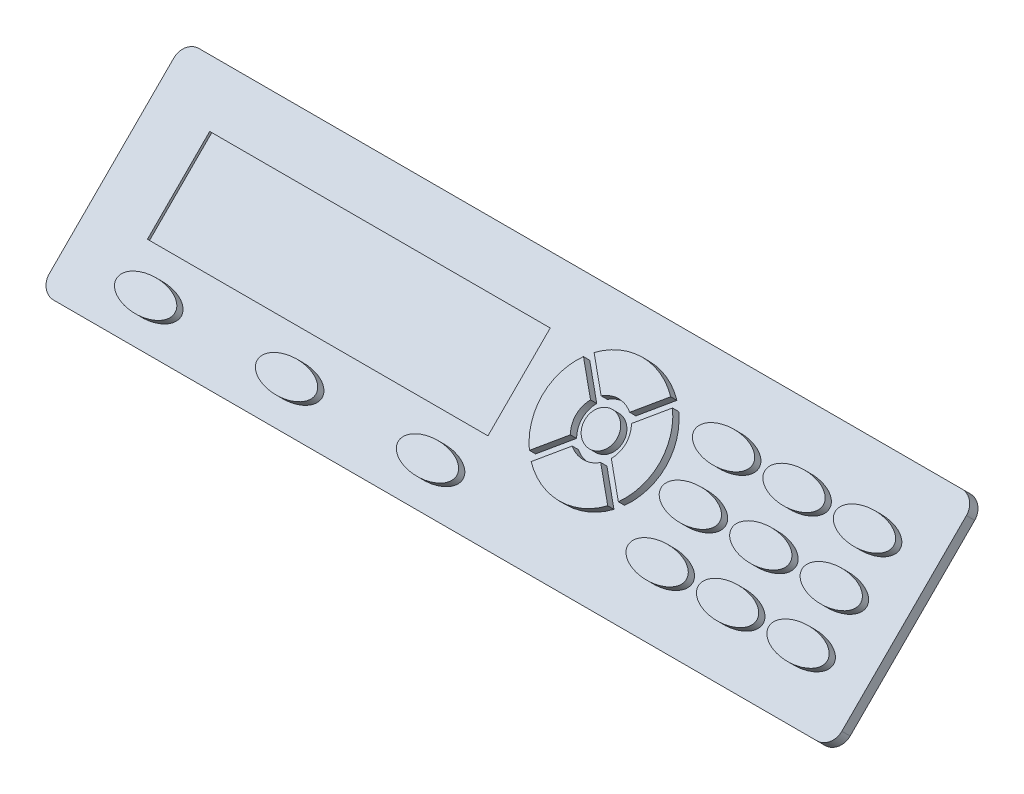
from build123d import *

# Parameters (mm, degrees)
BOSS_EXTRUDE1_DEPTH     = 90
FILLET1_R               = 7.5
FILLET2_R               = 2
SKETCH2_W               = 20
SKETCH2_H               = 80
SKETCH2_W_2             = 32
BOSS_EXTRUDE2_DEPTH     = 20
SKETCH3_R               = 2.5
BOSS_EXTRUDE3_DEPTH     = 111
BOSS_EXTRUDE4_START     = 7.5
SKETCH4_W               = 80
SKETCH4_H               = 20
SKETCH4_R               = 3.25
BOSS_EXTRUDE4_DEPTH     = 20
MOVE_FACE1_BY           = 1.5
MOVE_FACE2_BY           = 1.5
FILLET3_R               = 4
FILLET4_R               = 4
CUT_EXTRUDE1_DEPTH      = 2
BOSS_EXTRUDE5_DEPTH     = 2
SKETCH7_W               = 58
SKETCH7_H               = 15
CUT_EXTRUDE2_DEPTH      = 0.5
SKETCH8_R               = 10
BOSS_EXTRUDE6_DEPTH     = 1.5
SKETCH10_R              = 4.25
SKETCH10_R_2            = 2.75
CUT_EXTRUDE_THIN1_DEPTH = 1.5
SKETCH11_RX             = 5
SKETCH11_RY             = 2.5
BOSS_EXTRUDE7_DEPTH     = 1.5
LPATTERN1_COUNT         = 3
LPATTERN1_PITCH         = 24
SKETCH12_RX             = 5
SKETCH12_RY             = 2.5
BOSS_EXTRUDE8_DEPTH     = 1.5
LPATTERN2_COUNT         = 3
LPATTERN2_PITCH         = 12
LPATTERN2_COUNT_DIR2    = 3
LPATTERN2_PITCH_DIR2    = 8
FILLET7_R               = 7.5
FILLET5_R               = 5
FILLET6_R               = 2
SHELL1_T                = -1
SKETCH14_R              = 14
BOSS_EXTRUDE9_DEPTH     = 1
BOSS_EXTRUDE10_DEPTH    = 1
BOSS_EXTRUDE11_START    = -30
SKETCH16_R              = 13
BOSS_EXTRUDE11_DEPTH    = 10
BOSS_EXTRUDE12_REACH    = 233.484
SKETCH18_R              = 3
SKETCH17_W              = 1.5
SKETCH17_H              = 20
SKETCH17_W_2            = 20
SKETCH17_H_2            = 1.5
EXTRUDE_THIN1_DEPTH     = 63.5
SKETCH20_R              = 12.5
BOSS_EXTRUDE13_DEPTH    = 5
FILLET8_R               = 2


# Read off the part's stored shape, not the designer's step: Body-Move/Copy1
with BuildPart() as part:
    # Sketch1 → Boss-Extrude1 (new, symmetric)
    with BuildSketch(Plane(origin=(0, 0, 0), x_dir=(0, 0, -1), z_dir=(1, 0, 0))):
        Polygon((0, 0), (0, 45), (-115, 45), (-160, 0), align=None)
    extrude(amount=BOSS_EXTRUDE1_DEPTH, both=True)

    # Fillet1
    fillet1_edges = [part.edges().sort_by_distance(p)[0] for p in [
        (0, 0, 160),
        (0, 45, 115),
        (0, 45, 0),
        (0, 0, 0),
    ]]
    fillet(fillet1_edges, radius=FILLET1_R)

    # Fillet2
    fillet2_edges = [part.edges().sort_by_distance(p)[0] for p in [
        (-90, 0, 74.696699141),
        (90, 0, 74.696699141),
        (-90, 27.803300859, 132.196699141),
        (-90, 45, 59.696699141),
        (-90, 22.5, 0),
        (-90, 44.429096494, 114.763524025),
        (-90, 2.196699141, 2.196699141),
        (-90, 42.803300859, 2.196699141),
        (-90, 4.629874257, 148.822494776),
        (90, 27.803300859, 132.196699141),
        (90, 22.5, 0),
        (90, 45, 59.696699141),
        (90, 44.429096494, 114.763524025),
        (90, 2.196699141, 2.196699141),
        (90, 42.803300859, 2.196699141),
        (90, 4.629874257, 148.822494776),
    ]]
    fillet(fillet2_edges, radius=FILLET2_R)

    # Sketch2 → Boss-Extrude2 (add)
    with BuildSketch(Plane(origin=(0, 45, 0), x_dir=(1, 0, 0), z_dir=(0, 1, 0))):
        with Locations((-71.5, -59.696699141)):
            Rectangle(SKETCH2_W, SKETCH2_H)
        with Locations((65.5, -59.696699141)):
            Rectangle(SKETCH2_W_2, SKETCH2_H)
    extrude(amount=BOSS_EXTRUDE2_DEPTH)

    # Sketch3 → Boss-Extrude3 (add)
    with BuildSketch(Plane(origin=(-61.5, 0, 0), x_dir=(0, 0, -1), z_dir=(1, 0, 0))):
        with Locations(Location((-89.696699141, 59.5, 0), (0, 0, 180))):
            Circle(SKETCH3_R)
        with Locations(Location((-89.696699141, 50.5, 0), (0, 0, 180))):
            Circle(SKETCH3_R)
        with Locations(Location((-29.696699141, 50.5, 0), (0, 0, 180))):
            Circle(SKETCH3_R)
        with Locations(Location((-29.696699141, 59.5, 0), (0, 0, 180))):
            Circle(SKETCH3_R)
    extrude(amount=BOSS_EXTRUDE3_DEPTH)

    # Fillet3
    fillet3_edges = [part.edges().sort_by_distance(p)[0] for p in [
        (65.5, 65, 99.696699141),
        (65.5, 65, 19.696699141),
        (-71.5, 65, 99.696699141),
        (-71.5, 65, 19.696699141),
    ]]
    fillet(fillet3_edges, radius=FILLET3_R)

    # Sketch5 → Cut-Extrude1 (cut)
    with BuildSketch(Plane(origin=(0, 80, 80), x_dir=(1, 0, 0), z_dir=(0, 0.7071067811865511, 0.707106781186544))):
        with BuildLine():
            Line((-65, -56.317279836), (65, -56.317279836))
            ThreePointArc((65, -56.317279836), (66.767766953, -57.049512883), (67.5, -58.817279836))
            Line((67.5, -58.817279836), (67.5, -88.817279836))
            ThreePointArc((67.5, -88.817279836), (66.767766953, -90.585046789), (65, -91.317279836))
            Line((65, -91.317279836), (-65, -91.317279836))
            ThreePointArc((-65, -91.317279836), (-66.767766953, -90.585046789), (-67.5, -88.817279836))
            Line((-67.5, -88.817279836), (-67.5, -58.817279836))
            ThreePointArc((-67.5, -58.817279836), (-66.767766953, -57.049512883), (-65, -56.317279836))
        make_face()
    extrude(amount=-CUT_EXTRUDE1_DEPTH, mode=Mode.SUBTRACT)


with BuildPart() as body_2:
    # Sketch4 → Boss-Extrude4 (new body)
    with BuildSketch(Plane(origin=(-61.5, 0, 0), x_dir=(0, 0, -1), z_dir=(1, 0, 0)).offset(BOSS_EXTRUDE4_START)):
        with Locations((-59.696699141, 55)):
            Rectangle(SKETCH4_W, SKETCH4_H)
        with Locations((-89.696699141, 59.5)):
            Circle(SKETCH4_R, mode=Mode.SUBTRACT)
        with Locations((-89.696699141, 50.5)):
            Circle(SKETCH4_R, mode=Mode.SUBTRACT)
        with Locations((-29.696699141, 59.5)):
            Circle(SKETCH4_R, mode=Mode.SUBTRACT)
        with Locations((-29.696699141, 50.5)):
            Circle(SKETCH4_R, mode=Mode.SUBTRACT)
    extrude(amount=BOSS_EXTRUDE4_DEPTH)

    # Move Face1: a face moved outward by 1.5
    extrude(body_2.faces().sort_by_distance((-44, 65, 59.696699141))[0], amount=MOVE_FACE1_BY, dir=(0, 1, 0))

    # Move Face2: a face moved inward by 1.5
    extrude(body_2.faces().sort_by_distance((-44, 45, 59.696699141))[0], amount=MOVE_FACE2_BY, dir=(0, 1, 0), mode=Mode.SUBTRACT)

    # Fillet4
    fillet4_edges = [body_2.edges().sort_by_distance(p)[0] for p in [
        (-44, 66.5, 99.696699141),
        (-44, 66.5, 19.696699141),
        (-44, 46.5, 19.696699141),
        (-44, 46.5, 99.696699141),
    ]]
    fillet(fillet4_edges, radius=FILLET4_R)


with BuildPart() as body_3:
    # Sketch6 → Boss-Extrude5 (new body)
    with BuildSketch(Plane(origin=(0, 78.585786438, 78.585786438), x_dir=(1, 0, 0), z_dir=(0, 0.7071067811865509, 0.7071067811865441))):
        with BuildLine():
            Line((65, -56.317279836), (-65, -56.317279836))
            ThreePointArc((-65, -56.317279836), (-66.767766953, -57.049512883), (-67.5, -58.817279836))
            Line((-67.5, -58.817279836), (-67.5, -88.817279836))
            ThreePointArc((-67.5, -88.817279836), (-66.767766953, -90.585046789), (-65, -91.317279836))
            Line((-65, -91.317279836), (65, -91.317279836))
            ThreePointArc((65, -91.317279836), (66.767766953, -90.585046789), (67.5, -88.817279836))
            Line((67.5, -88.817279836), (67.5, -58.817279836))
            ThreePointArc((67.5, -58.817279836), (66.767766953, -57.049512883), (65, -56.317279836))
        make_face()
    extrude(amount=BOSS_EXTRUDE5_DEPTH)

    # Sketch7 → Cut-Extrude2 (cut)
    with BuildSketch(Plane(origin=(0, 80, 80), x_dir=(1, 0, 0), z_dir=(0, 0.7071067811865509, 0.7071067811865441))):
        with Locations((-28.5, -71.817279836)):
            Rectangle(SKETCH7_W, SKETCH7_H)
    extrude(amount=-CUT_EXTRUDE2_DEPTH, mode=Mode.SUBTRACT)

    # Sketch8 → Boss-Extrude6 (add)
    with BuildSketch(Plane(origin=(0, 80, 80), x_dir=(1, 0, 0), z_dir=(0, 0.7071067811865509, 0.7071067811865441))):
        with Locations(Location((15.5, -71.817279836, 0), (0, 0, 270))):
            Circle(SKETCH8_R)
    extrude(amount=BOSS_EXTRUDE6_DEPTH)

    # Sketch10 → Cut-Extrude-Thin1 (cut)
    # profile 1 of 5: a face of its own
    with BuildSketch(Plane(origin=(0, 81.060660172, 81.060660172), x_dir=(1, 0, 0), z_dir=(0, 0.7071067811865509, 0.7071067811865441))):
        with Locations((15.5, -71.817279836)):
            Circle(SKETCH10_R)
        with Locations((15.5, -71.817279836)):
            Circle(SKETCH10_R_2, mode=Mode.SUBTRACT)
    # profile 2 of 5: a face of its own
    with BuildSketch(Plane(origin=(0, 81.060660172, 81.060660172), x_dir=(1, 0, 0), z_dir=(0, 0.7071067811865509, 0.7071067811865441))):
        Polygon((7.898602102, -65.27654211), (12.49479618, -69.872736188), (13.555456352, -68.812076016), (8.959262274, -64.215881939), align=None)
    # profile 3 of 5: a face of its own
    with BuildSketch(Plane(origin=(0, 81.060660172, 81.060660172), x_dir=(1, 0, 0), z_dir=(0, 0.7071067811865509, 0.7071067811865441))):
        Polygon((22.040737726, -64.215881939), (17.444543648, -68.812076016), (18.50520382, -69.872736188), (23.101397898, -65.27654211), align=None)
    # profile 4 of 5: a face of its own
    with BuildSketch(Plane(origin=(0, 81.060660172, 81.060660172), x_dir=(1, 0, 0), z_dir=(0, 0.7071067811865509, 0.7071067811865441))):
        Polygon((17.444543648, -74.822483656), (22.040737726, -79.418677734), (23.101397898, -78.358017562), (18.50520382, -73.761823485), align=None)
    # profile 5 of 5: a face of its own
    with BuildSketch(Plane(origin=(0, 81.060660172, 81.060660172), x_dir=(1, 0, 0), z_dir=(0, 0.7071067811865509, 0.7071067811865441))):
        Polygon((12.49479618, -73.761823485), (7.898602102, -78.358017562), (8.959262274, -79.418677734), (13.555456352, -74.822483656), align=None)
    extrude(amount=-CUT_EXTRUDE_THIN1_DEPTH, mode=Mode.SUBTRACT)

    # Sketch11 → Boss-Extrude7 (add)
    with BuildSketch(Plane(origin=(0, 80, 80), x_dir=(1, 0, 0), z_dir=(0, 0.7071067811865509, 0.7071067811865441))):
        with Locations((-52.5, -85.317279836)):
            Ellipse(SKETCH11_RX, SKETCH11_RY)
    boss_extrude7 = extrude(amount=BOSS_EXTRUDE7_DEPTH)

    # LPattern1: Boss-Extrude7 ×3
    with Locations(*[(i * LPATTERN1_PITCH, 0, 0) for i in range(1, LPATTERN1_COUNT)]):
        add(boss_extrude7)

    # Sketch12 → Boss-Extrude8 (add)
    with BuildSketch(Plane(origin=(0, 80, 80), x_dir=(1, 0, 0), z_dir=(0, 0.7071067811865509, 0.7071067811865441))):
        with Locations((32.5, -66.317279836)):
            Ellipse(SKETCH12_RX, SKETCH12_RY)
    boss_extrude8 = extrude(amount=BOSS_EXTRUDE8_DEPTH)

    # LPattern2: Boss-Extrude8 3 × 3
    with Locations(*[Vector(1, 0, 0) * (i * LPATTERN2_PITCH) + Vector(0, -0.7071067811865442, 0.7071067811865508) * (j * LPATTERN2_PITCH_DIR2) for i in range(LPATTERN2_COUNT) for j in range(LPATTERN2_COUNT_DIR2) if (i, j) != (0, 0)]):
        add(boss_extrude8)


with BuildPart() as body_4:
    # Sketch13 → Revolve1 (revolve)
    with BuildSketch(Plane.XY.offset(59.696699141), mode=Mode.PRIVATE) as revolve1_sk:
        Polygon((11.5, 70), (11.5, 85), (105.301145933, 85), (111.5, 74.263269807), (121.5, 72.5), (121.5, 70), align=None)
    revolve(revolve1_sk.sketch.rotate(Axis((11.5, 70, 59.696699141), (1, 0, 0)), 90), axis=Axis((11.5, 70, 59.696699141), (1, 0, 0)))

    # Fillet5
    fillet5_edges = [body_4.edges().sort_by_distance(p)[0] for p in [
        (105.301145933, 70, 44.696699141),
    ]]
    fillet(fillet5_edges, radius=FILLET5_R)

    # Fillet6
    fillet6_edges = [body_4.edges().sort_by_distance(p)[0] for p in [
        (111.5, 70, 55.433429334),
    ]]
    fillet(fillet6_edges, radius=FILLET6_R)

    # Shell1
    shell1_openings = [body_4.faces().sort_by_distance(p)[0] for p in [
        (121.5, 70, 59.696699141),
        (11.5, 70, 59.696699141),
    ]]
    offset(amount=SHELL1_T, openings=shell1_openings, kind=Kind.INTERSECTION)

    # Sketch14 → Boss-Extrude9 (add)
    with BuildSketch(Plane.ZY.offset(-11.5)):
        with BuildLine():
            Line((55.696699141, 85.491933385), (40.696699141, 81.618950039))
            ThreePointArc((40.696699141, 81.618950039), (31.696699141, 70), (40.696699141, 58.381049961))
            Line((40.696699141, 58.381049961), (55.696699141, 54.508066615))
            ThreePointArc((55.696699141, 54.508066615), (59.696699141, 54), (63.696699141, 54.508066615))
            Line((63.696699141, 54.508066615), (78.696699141, 58.381049961))
            ThreePointArc((78.696699141, 58.381049961), (87.696699141, 70), (78.696699141, 81.618950039))
            Line((78.696699141, 81.618950039), (63.696699141, 85.491933385))
            ThreePointArc((63.696699141, 85.491933385), (59.696699141, 86), (55.696699141, 85.491933385))
        make_face()
        with Locations((59.696699141, 70)):
            Circle(SKETCH14_R, mode=Mode.SUBTRACT)
    extrude(amount=BOSS_EXTRUDE9_DEPTH)


with BuildPart() as body_5:
    # Body-Move/Copy1 outline → Body-Move/Copy1 (revolve)
    with BuildSketch(Plane(origin=(0, 70, 59.696699141), x_dir=(0, 1, 0), z_dir=(0, 0, -1))):
        Polygon((0, 121.5), (0, 11.5), (15, 11.5), (15, 105.301145933), (4.263269807, 111.5), (2.5, 121.5), align=None)
    revolve(axis=Axis((0, 70, 59.696699141), (1, 0, 0)))


with BuildPart() as part_1:
    add(part.part)

    # Combine1: cut body 5
    add(body_5.part, mode=Mode.SUBTRACT)

    # Fillet7
    fillet7_edges = [part_1.edges().sort_by_distance(p)[0] for p in [
        (65.5, 65, 73.838834765),
        (65.5, 65, 45.554563517),
    ]]
    fillet(fillet7_edges, radius=FILLET7_R)

    # Sketch20 → Boss-Extrude13 (add)
    with BuildSketch(Plane.XZ):
        with Locations(Location((-60, 116.893398282, 0), (0, 0, 90))):
            Circle(SKETCH20_R)
        with Locations(Location((-60, 32.5, 0), (0, 0, 90))):
            Circle(SKETCH20_R)
        with Locations(Location((60, 32.5, 0), (0, 0, 90))):
            Circle(SKETCH20_R)
        with Locations(Location((60, 116.893398282, 0), (0, 0, 90))):
            Circle(SKETCH20_R)
    extrude(amount=BOSS_EXTRUDE13_DEPTH)

    # Fillet8
    fillet8_edges = [part_1.edges().sort_by_distance(p)[0] for p in [
        (-60, -5, 104.393398282),
        (-60, -5, 20),
        (60, -5, 20),
        (60, -5, 104.393398282),
    ]]
    fillet(fillet8_edges, radius=FILLET8_R)


with BuildPart() as body_5_2:
    # Sketch15 → Boss-Extrude10 (new body)
    with BuildSketch(Plane(origin=(-34, 0, 0), x_dir=(0, 0, -1), z_dir=(1, 0, 0))):
        with BuildLine():
            Line((-63.696699141, 85.491933385), (-78.696699141, 81.618950039))
            ThreePointArc((-78.696699141, 81.618950039), (-87.696699141, 70), (-78.696699141, 58.381049961))
            Line((-78.696699141, 58.381049961), (-63.696699141, 54.508066615))
            ThreePointArc((-63.696699141, 54.508066615), (-59.696699141, 54), (-55.696699141, 54.508066615))
            Line((-55.696699141, 54.508066615), (-40.696699141, 58.381049961))
            ThreePointArc((-40.696699141, 58.381049961), (-31.696699141, 70), (-40.696699141, 81.618950039))
            Line((-40.696699141, 81.618950039), (-55.696699141, 85.491933385))
            ThreePointArc((-55.696699141, 85.491933385), (-59.696699141, 86), (-63.696699141, 85.491933385))
        make_face()
    extrude(amount=BOSS_EXTRUDE10_DEPTH)


with BuildPart() as body_6:
    # Sketch16 → Boss-Extrude11 (new body)
    with BuildSketch(Plane.ZY.offset(-10.5).offset(BOSS_EXTRUDE11_START)):
        with Locations((59.696699141, 70)):
            Circle(SKETCH16_R)
    extrude(amount=BOSS_EXTRUDE11_DEPTH)

    # Sketch18 → Boss-Extrude12 (add, up to next)
    with BuildSketch(Plane(origin=(-33, 0, 0), x_dir=(0, 0, -1), z_dir=(1, 0, 0)), mode=Mode.PRIVATE) as boss_extrude12_sk1:
        with Locations(Location((-59.696699141, 70, 0), (0, 0, 180))):
            Circle(SKETCH18_R)
    boss_extrude12_tool1 = extrude(boss_extrude12_sk1.sketch, amount=BOSS_EXTRUDE12_REACH, mode=Mode.PRIVATE) - body_6.part

    add(body_5_2.part)  # Boss-Extrude12 merges body 5 2
    add(boss_extrude12_tool1.solids().sort_by_distance((-33, 70, 59.696699))[0])

    # Sketch17 → Extrude-Thin1 (add)
    with BuildSketch(Plane(origin=(-33, 0, 0), x_dir=(0, 0, -1), z_dir=(1, 0, 0))):
        with Locations((-59.696699141, 70)):
            Rectangle(SKETCH17_W, SKETCH17_H)
        with Locations((-59.696699141, 70)):
            Rectangle(SKETCH17_W_2, SKETCH17_H_2)
    extrude(amount=EXTRUDE_THIN1_DEPTH)

    # Sketch19 → Cut-Revolve3 (revolve, cut)
    with BuildSketch(Plane.XY.offset(59.696699141), mode=Mode.PRIVATE) as cut_revolve3_sk:
        Polygon((-33, 76.452368755), (-18, 80), (-18, 81.618950039), (-33, 81.618950039), align=None)
    revolve(cut_revolve3_sk.sketch.rotate(Axis((111.5, 70, 59.696699141), (-1, 0, 0)), 270), axis=Axis((111.5, 70, 59.696699141), (-1, 0, 0)), mode=Mode.SUBTRACT)


solid = body_3.part
